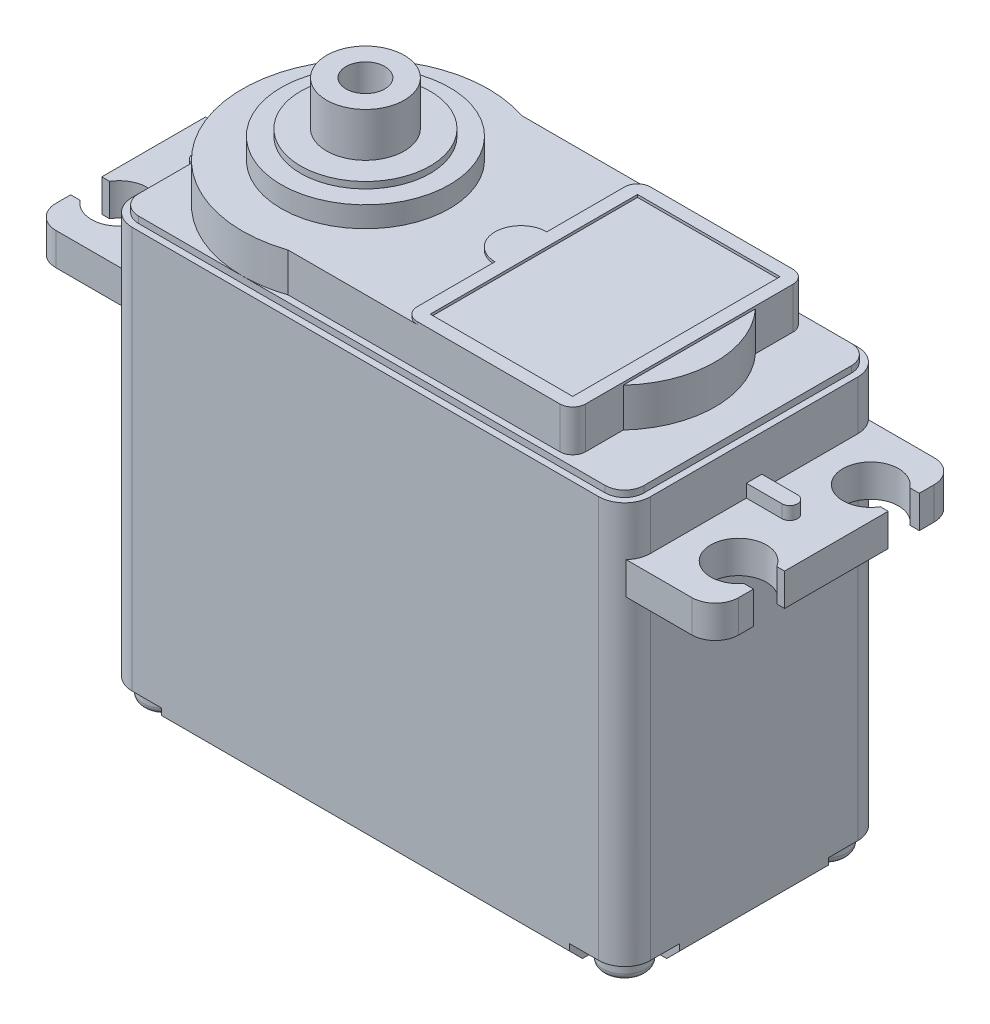
from build123d import *

# Parameters (mm, degrees)
EXTRUDE_1_DEPTH     = 32.5
EXTRUDE_2_DEPTH     = 0.5
CUT_EXTRUDE_1_DEPTH = 1.5
CHAMFER_1_SIZE      = 1
EXTRUDE_3_DEPTH     = 3
SKETCH_5_W          = 11
SKETCH_5_H          = 16
EXTRUDE_4_DEPTH     = 0.2
SKETCH_6_R          = 6.5
EXTRUDE_5_DEPTH     = 1.6
SKETCH_7_R          = 5
EXTRUDE_6_DEPTH     = 0.5
SKETCH_8_R          = 3
SKETCH_8_R_2        = 1.5
EXTRUDE_7_DEPTH     = 3.4
EXTRUDE_8_DEPTH     = 3
EXTRUDE_START       = 0.3
EXTRUDE_9_DEPTH     = 2.5
EXTRUDE_10_DEPTH    = 1
SKETCH_12_R         = 1.65
EXTRUDE_11_DEPTH    = 1.5
FILLET_1_R          = 0.5
SKETCH_1_2_W        = 7
SKETCH_1_2_H        = 5
EXTRUDE_1_2_DEPTH   = 22.5


with BuildPart() as part:
    # Sketch 1 → Extrude 1 (new body)
    with BuildSketch(Plane(origin=(0, 0, 0), x_dir=(1, 0, 0), z_dir=(0, 1, 0))):
        with BuildLine():
            Line((-18, -10), (18, -10))
            ThreePointArc((18, -10), (19.414213562, -9.414213562), (20, -8))
            Line((20, -8), (20, 8))
            ThreePointArc((20, 8), (19.414213562, 9.414213562), (18, 10))
            Line((18, 10), (-18, 10))
            ThreePointArc((-18, 10), (-19.414213562, 9.414213562), (-20, 8))
            Line((-20, 8), (-20, -8))
            ThreePointArc((-20, -8), (-19.414213562, -9.414213562), (-18, -10))
        make_face()
    extrude(amount=EXTRUDE_1_DEPTH)

    # Эскиз2 → Бобышка-Вытянуть2 (add)
    with BuildSketch(Plane(origin=(0, 32.5, 0), x_dir=(1, 0, 0), z_dir=(0, 1, 0))):
        with BuildLine():
            Line((-18, -9.5), (18, -9.5))
            ThreePointArc((18, -9.5), (19.060660172, -9.060660172), (19.5, -8))
            Line((19.5, -8), (19.5, 8))
            ThreePointArc((19.5, 8), (19.060660172, 9.060660172), (18, 9.5))
            Line((18, 9.5), (-18, 9.5))
            ThreePointArc((-18, 9.5), (-19.060660172, 9.060660172), (-19.5, 8))
            Line((-19.5, 8), (-19.5, -8))
            ThreePointArc((-19.5, -8), (-19.060660172, -9.060660172), (-18, -9.5))
        make_face()
    extrude(amount=EXTRUDE_2_DEPTH)

    # Эскиз3 → Вырез-Вытянуть1 (cut)
    with BuildSketch(Plane.XZ):
        with BuildLine():
            Line((-21.918547291, 5.75), (-17.75, 5.75))
            ThreePointArc((-17.75, 5.75), (-16.335786438, 6.335786438), (-15.75, 7.75))
            Line((-15.75, 7.75), (-15.75, 12.092571755))
            Line((-15.75, 12.092571755), (-21.918547291, 12.092571755))
            Line((-21.918547291, 12.092571755), (-21.918547291, 5.75))
        make_face()
        with BuildLine():
            Line((15.75, 12.092571755), (21.918547291, 12.092571755))
            Line((21.918547291, 12.092571755), (21.918547291, 5.75))
            Line((21.918547291, 5.75), (17.75, 5.75))
            ThreePointArc((17.75, 5.75), (16.335786438, 6.335786438), (15.75, 7.75))
            Line((15.75, 7.75), (15.75, 12.092571755))
        make_face()
        with BuildLine():
            Line((21.918547291, -5.75), (17.75, -5.75))
            ThreePointArc((17.75, -5.75), (16.335786438, -6.335786438), (15.75, -7.75))
            Line((15.75, -7.75), (15.75, -12.092571755))
            Line((15.75, -12.092571755), (21.918547291, -12.092571755))
            Line((21.918547291, -12.092571755), (21.918547291, -5.75))
        make_face()
        with BuildLine():
            Line((-15.75, -12.092571755), (-21.918547291, -12.092571755))
            Line((-21.918547291, -12.092571755), (-21.918547291, -5.75))
            Line((-21.918547291, -5.75), (-17.75, -5.75))
            ThreePointArc((-17.75, -5.75), (-16.335786438, -6.335786438), (-15.75, -7.75))
            Line((-15.75, -7.75), (-15.75, -12.092571755))
        make_face()
    extrude(amount=-CUT_EXTRUDE_1_DEPTH, mode=Mode.SUBTRACT)

    # Фаска1
    chamfer_1_edges = [part.edges().sort_by_distance(p)[0] for p in [
        (-20, 0, 0),
        (0, 0, 10),
        (20, 0, 0),
        (0, 0, -10),
    ]]
    chamfer(chamfer_1_edges, length=CHAMFER_1_SIZE)

    # Эскиз4 → Бобышка-Вытянуть3 (add)
    with BuildSketch(Plane(origin=(0, 33, 0), x_dir=(1, 0, 0), z_dir=(0, 1, 0))):
        with BuildLine():
            Line((15, 8), (15, -8))
            ThreePointArc((15, -8), (14.707106781, -8.707106781), (14, -9))
            Line((14, -9), (-6.958618735, -9))
            ThreePointArc((-6.958618735, -9), (-19.5, 0), (-6.958618735, 9))
            Line((-6.958618735, 9), (14, 9))
            ThreePointArc((14, 9), (14.707106781, 8.707106781), (15, 8))
        make_face()
    extrude(amount=EXTRUDE_3_DEPTH)

    # Эскиз5 → Бобышка-Вытянуть4 (add)
    # profile 1 of 2: a face of its own
    with BuildSketch(Plane(origin=(0, 36, 0), x_dir=(1, 0, 0), z_dir=(0, 1, 0))):
        with BuildLine():
            ThreePointArc((2, 2), (0, 0), (2, -2))
            Line((2, -2), (2, 2))
        make_face()
    # profile 2 of 2: a face of its own
    with BuildSketch(Plane(origin=(0, 36, 0), x_dir=(1, 0, 0), z_dir=(0, 1, 0))):
        with BuildLine():
            ThreePointArc((14, -9), (14.707106781, -8.707106781), (15, -8))
            Line((15, -8), (15, 8))
            ThreePointArc((15, 8), (14.707106781, 8.707106781), (14, 9))
            Line((14, 9), (3, 9))
            ThreePointArc((3, 9), (2.292893219, 8.707106781), (2, 8))
            Line((2, 8), (2, 2))
            Line((2, 2), (2, -2))
            Line((2, -2), (2, -8))
            ThreePointArc((2, -8), (2.292893219, -8.707106781), (3, -9))
            Line((3, -9), (14, -9))
        make_face()
        with Locations((8.5, 0)):
            Rectangle(SKETCH_5_W, SKETCH_5_H, mode=Mode.SUBTRACT)
    extrude(amount=EXTRUDE_4_DEPTH)

    # Эскиз6 → Бобышка-Вытянуть5 (add)
    with BuildSketch(Plane(origin=(0, 36, 0), x_dir=(1, 0, 0), z_dir=(0, 1, 0))):
        with Locations(Location((-10, 0, 0), (0, 0, 270))):
            Circle(SKETCH_6_R)
    extrude(amount=EXTRUDE_5_DEPTH)

    # Эскиз7 → Бобышка-Вытянуть6 (add)
    with BuildSketch(Plane(origin=(0, 37.6, 0), x_dir=(1, 0, 0), z_dir=(0, 1, 0))):
        with Locations(Location((-10, 0, 0), (0, 0, 270))):
            Circle(SKETCH_7_R)
    extrude(amount=EXTRUDE_6_DEPTH)

    # Эскиз8 → Бобышка-Вытянуть7 (add)
    with BuildSketch(Plane(origin=(0, 38.1, 0), x_dir=(1, 0, 0), z_dir=(0, 1, 0))):
        with Locations(Location((-10, 0, 0), (0, 0, 270))):
            Circle(SKETCH_8_R)
        with Locations(Location((-10, 0, 0), (0, 0, 270))):
            Circle(SKETCH_8_R_2, mode=Mode.SUBTRACT)
    extrude(amount=EXTRUDE_7_DEPTH)

    # Эскиз9 → Бобышка-Вытянуть8 (add)
    with BuildSketch(Plane(origin=(0, 33, 0), x_dir=(1, 0, 0), z_dir=(0, 1, 0))):
        with BuildLine():
            Line((14.5, 5.590169944), (14.5, -5.590169944))
            ThreePointArc((14.5, -5.590169944), (17, 0), (14.5, 5.590169944))
        make_face()
    extrude(amount=EXTRUDE_8_DEPTH)

    # Эскиз10 → Бобышка-Вытянуть9 (add)
    with BuildSketch(Plane(origin=(0, 26.5, 0), x_dir=(-1, 0, 0), z_dir=(0, -1, 0)).offset(EXTRUDE_START)):
        with BuildLine():
            Line((-26.35, 6.4), (-25.612454379, 6.4))
            ThreePointArc((-25.612454379, 6.4), (-21.753385344, 4.979395191), (-25.74729532, 4))
            Line((-25.74729532, 4), (-26.35, 4))
            Line((-26.35, 4), (-26.35, -4))
            Line((-26.35, -4), (-25.74729532, -4))
            ThreePointArc((-25.74729532, -4), (-21.753385344, -4.979395191), (-25.612454379, -6.4))
            Line((-25.612454379, -6.4), (-26.35, -6.4))
            Line((-26.35, -6.4), (-26.35, -7.538401811))
            ThreePointArc((-26.35, -7.538401811), (-25.819395175, -8.819395175), (-24.538401811, -9.35))
            Line((-24.538401811, -9.35), (24.538401811, -9.35))
            ThreePointArc((24.538401811, -9.35), (25.819395175, -8.819395175), (26.35, -7.538401811))
            Line((26.35, -7.538401811), (26.35, -6.4))
            Line((26.35, -6.4), (25.612454379, -6.4))
            ThreePointArc((25.612454379, -6.4), (21.753385344, -4.979395191), (25.74729532, -4))
            Line((25.74729532, -4), (26.35, -4))
            Line((26.35, -4), (26.35, 4))
            Line((26.35, 4), (25.74729532, 4))
            ThreePointArc((25.74729532, 4), (21.753385344, 4.979395191), (25.612454379, 6.4))
            Line((25.612454379, 6.4), (26.35, 6.4))
            Line((26.35, 6.4), (26.35, 7.538401811))
            ThreePointArc((26.35, 7.538401811), (25.819395175, 8.819395175), (24.538401811, 9.35))
            Line((24.538401811, 9.35), (-24.538401811, 9.35))
            ThreePointArc((-24.538401811, 9.35), (-25.819395175, 8.819395175), (-26.35, 7.538401811))
            Line((-26.35, 7.538401811), (-26.35, 6.4))
        make_face()
    extrude(amount=-EXTRUDE_9_DEPTH)

    # Эскиз11 → Бобышка-Вытянуть10 (add)
    with BuildSketch(Plane(origin=(0, 28.7, 0), x_dir=(1, 0, 0), z_dir=(0, 1, 0))):
        with BuildLine():
            Line((22.75, 0.6), (18.027551533, 0.6))
            Line((18.027551533, 0.6), (18.027551533, -0.6))
            Line((18.027551533, -0.6), (22.75, -0.6))
            ThreePointArc((22.75, -0.6), (23.35, 0), (22.75, 0.6))
        make_face()
        with BuildLine():
            Line((-22.75, 0.6), (-18.027551533, 0.6))
            Line((-18.027551533, 0.6), (-18.027551533, -0.6))
            Line((-18.027551533, -0.6), (-22.75, -0.6))
            ThreePointArc((-22.75, -0.6), (-23.35, 0), (-22.75, 0.6))
        make_face()
    extrude(amount=EXTRUDE_10_DEPTH)

    # Эскиз12 → Бобышка-Вытянуть11 (add)
    # profile 1 of 4: a face of its own
    with BuildSketch(Plane.XZ.offset(-1.5)):
        with Locations(Location((-17.75, 7.75, 0), (0, 0, 90))):
            Circle(SKETCH_12_R)
        Polygon((-18, 8), (-19, 8), (-19, 7.5), (-18, 7.5), (-18, 6.5), (-17.5, 6.5), (-17.5, 7.5), (-16.5, 7.5), (-16.5, 8), (-17.5, 8), (-17.5, 9), (-18, 9), align=None, mode=Mode.SUBTRACT)
    # profile 2 of 4: a face of its own
    with BuildSketch(Plane.XZ.offset(-1.5)):
        with Locations(Location((17.75, 7.75, 0), (0, 0, 90))):
            Circle(SKETCH_12_R)
        Polygon((16.5, 7.5), (16.5, 8), (17.5, 8), (17.5, 9), (18, 9), (18, 8), (19, 8), (19, 7.5), (18, 7.5), (18, 6.5), (17.5, 6.5), (17.5, 7.5), align=None, mode=Mode.SUBTRACT)
    # profile 3 of 4: a face of its own
    with BuildSketch(Plane.XZ.offset(-1.5)):
        with Locations(Location((17.75, -7.75, 0), (0, 0, 90))):
            Circle(SKETCH_12_R)
        Polygon((16.5, -8), (17.5, -8), (17.5, -9), (18, -9), (18, -8), (19, -8), (19, -7.5), (18, -7.5), (18, -6.5), (17.5, -6.5), (17.5, -7.5), (16.5, -7.5), align=None, mode=Mode.SUBTRACT)
    # profile 4 of 4: a face of its own
    with BuildSketch(Plane.XZ.offset(-1.5)):
        with Locations(Location((-17.75, -7.75, 0), (0, 0, 90))):
            Circle(SKETCH_12_R)
        Polygon((-17.5, -6.5), (-17.5, -7.5), (-16.5, -7.5), (-16.5, -8), (-17.5, -8), (-17.5, -9), (-18, -9), (-18, -8), (-19, -8), (-19, -7.5), (-18, -7.5), (-18, -6.5), align=None, mode=Mode.SUBTRACT)
    extrude(amount=EXTRUDE_11_DEPTH)

    # Скругление1
    # the kernel refuses this fillet: 0.5 mm, written as the material it takes off along each edge
    with BuildSketch(Plane(origin=(17.75, 0, 7.75), x_dir=(0, 0, 1), z_dir=(1, 0, 0))) as fillet_1_piece_1:
        with BuildLine():
            CenterArc((1.65 - FILLET_1_R, -FILLET_1_R), FILLET_1_R, 0, 90)
            Line((1.65 - FILLET_1_R, 0), (1.65, 0))
            Line((1.65, 0), (1.65, -FILLET_1_R))
        make_face()
    revolve(axis=Axis((17.75, 0, 7.75), (0, -1, 0)), mode=Mode.SUBTRACT)
    with BuildSketch(Plane(origin=(17.75, 0, -7.75), x_dir=(0, 0, 1), z_dir=(1, 0, 0))) as fillet_1_piece_2:
        with BuildLine():
            CenterArc((1.65 - FILLET_1_R, -FILLET_1_R), FILLET_1_R, 0, 90)
            Line((1.65 - FILLET_1_R, 0), (1.65, 0))
            Line((1.65, 0), (1.65, -FILLET_1_R))
        make_face()
    revolve(axis=Axis((17.75, 0, -7.75), (0, -1, 0)), mode=Mode.SUBTRACT)
    with BuildSketch(Plane(origin=(-17.75, 0, -7.75), x_dir=(0, 0, 1), z_dir=(1, 0, 0))) as fillet_1_piece_3:
        with BuildLine():
            CenterArc((1.65 - FILLET_1_R, -FILLET_1_R), FILLET_1_R, 0, 90)
            Line((1.65 - FILLET_1_R, 0), (1.65, 0))
            Line((1.65, 0), (1.65, -FILLET_1_R))
        make_face()
    revolve(axis=Axis((-17.75, 0, -7.75), (0, -1, 0)), mode=Mode.SUBTRACT)
    with BuildSketch(Plane(origin=(-17.75, 0, 7.75), x_dir=(0, 0, 1), z_dir=(1, 0, 0))) as fillet_1_piece_4:
        with BuildLine():
            CenterArc((1.65 - FILLET_1_R, -FILLET_1_R), FILLET_1_R, 0, 90)
            Line((1.65 - FILLET_1_R, 0), (1.65, 0))
            Line((1.65, 0), (1.65, -FILLET_1_R))
        make_face()
    revolve(axis=Axis((-17.75, 0, 7.75), (0, -1, 0)), mode=Mode.SUBTRACT)

    # Sketch 1 2 → Extrude 1 2 (add)
    with BuildSketch(Plane(origin=(0, 0, 0), x_dir=(0, 0, -1), z_dir=(1, 0, 0))):
        with Locations((0, 3.5)):
            Rectangle(SKETCH_1_2_W, SKETCH_1_2_H)
    extrude(amount=-EXTRUDE_1_2_DEPTH)


solid = part.part
